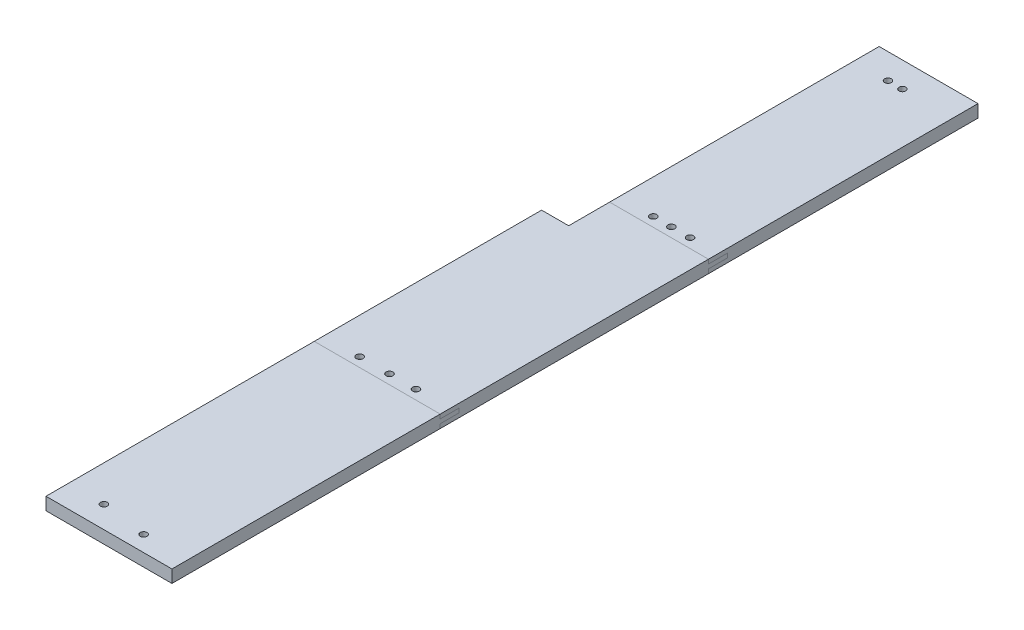
from build123d import *

# Parameters (mm, degrees)
BOSS_EXTRUDE1_DEPTH     = 10
CUT_EXTRUDE1_DEPTH      = 371.163218123
CUT_EXTRUDE1_DEPTH_BACK = 371.163218123
SKETCH2_W               = 11.607476636
SKETCH2_H               = 200
SKETCH3_W               = 10
SKETCH3_H               = 200
BOSS_EXTRUDE2_DEPTH     = 10
SKETCH4_W               = 1.61
SKETCH4_H               = 200
BOSS_EXTRUDE3_DEPTH     = 10
CUT_EXTRUDE2_DEPTH      = 371.163218123
CUT_EXTRUDE2_DEPTH_BACK = 371.163218123
SKETCH6_W               = 2.5
SKETCH6_H               = 200
SKETCH6_H_2             = 440
SKETCH7_W               = 9.997476636
SKETCH7_H               = 200
BOSS_EXTRUDE4_DEPTH     = 10
SKETCH8_W               = 40
SKETCH8_H               = 100
BOSS_EXTRUDE5_DEPTH     = 10
SKETCH9_W               = 2
SKETCH9_H               = 200
SKETCH9_W_2             = 3.5
SKETCH9_H_2             = 440
BOSS_EXTRUDE6_DEPTH     = 10
CUT_EXTRUDE3_DEPTH      = 372.00512896
CUT_EXTRUDE3_DEPTH_BACK = 372.00512896
SKETCH10_W              = 21.5
SKETCH10_H              = 46.5
CUT_EXTRUDE4_DEPTH      = 372.00512896
CUT_EXTRUDE4_DEPTH_BACK = 372.00512896
SKETCH11_R              = 2.65
SKETCH12_R              = 2.7
CUT_EXTRUDE5_DEPTH      = 372.00512896
SKETCH15_R              = 2.7
CUT_EXTRUDE6_DEPTH      = 372.00512896
SPLIT1_OUTLINE_W        = 78.5
SPLIT1_OUTLINE_H        = 199
SPLIT1_OUTLINE_R        = 2.65
SPLIT1_DEPTH            = 10
SPLIT1_2_OUTLINE_W      = 78.5
SPLIT1_2_OUTLINE_H      = 15
SPLIT1_2_OUTLINE_R      = 2.7
SPLIT1_2_DEPTH          = 3.33
SPLIT1_START            = 6.67
SPLIT1_3_OUTLINE_W      = 78.5
SPLIT1_3_OUTLINE_H      = 15
SPLIT1_3_OUTLINE_R      = 2.7
SPLIT1_3_DEPTH          = 3.33
SPLIT1_4_DEPTH          = 10
SPLIT1_5_OUTLINE_W      = 100
SPLIT1_5_OUTLINE_H      = 15
SPLIT1_5_OUTLINE_R      = 2.7
SPLIT1_5_DEPTH          = 3.33
SPLIT1_6_OUTLINE_W      = 100
SPLIT1_6_OUTLINE_H      = 15
SPLIT1_6_OUTLINE_R      = 2.7
SPLIT1_6_DEPTH          = 3.33
SPLIT1_START_2          = 3.33
SPLIT1_7_OUTLINE_W      = 78.5
SPLIT1_7_OUTLINE_H      = 15
SPLIT1_7_OUTLINE_R      = 2.7
SPLIT1_7_DEPTH          = 3.34
SPLIT1_8_OUTLINE_R      = 2.7
SPLIT1_8_OUTLINE_R_2    = 2.65
SPLIT1_8_DEPTH          = 10
SPLIT1_9_OUTLINE_W      = 100
SPLIT1_9_OUTLINE_H      = 15
SPLIT1_9_OUTLINE_R      = 2.7
SPLIT1_9_DEPTH          = 3.33
SPLIT1_10_OUTLINE_W     = 100
SPLIT1_10_OUTLINE_H     = 15
SPLIT1_10_OUTLINE_R     = 2.7
SPLIT1_10_DEPTH         = 3.33


# Read off the part's stored shape, not the designer's step: Split1
with BuildPart() as part:
    # Sketch1 → Boss-Extrude1 (new body)
    with BuildSketch(Plane(origin=(0, 0, 0), x_dir=(1, 0, 0), z_dir=(0, 1, 0))):
        Polygon((-57.392523364, 280.440053801), (11.607476636, 280.440053801), (11.607476636, 80.440053801), (11.607476636, -259.559946199), (11.607476636, -359.559946199), (-47.392523364, -359.559946199), (-47.392523364, -259.559946199), (-87.392523364, -259.559946199), (-87.392523364, 80.440053801), (-57.392523364, 80.440053801), align=None)
    extrude(amount=BOSS_EXTRUDE1_DEPTH)

    # Sketch2 → Cut-Extrude1 (cut, two sides: drawn at the far end of the back side and taken through both)
    with BuildSketch(Plane(origin=(0, 10, 0), x_dir=(1, 0, 0), z_dir=(0, 1, 0)).offset(-CUT_EXTRUDE1_DEPTH_BACK)):
        with Locations((5.803738318, 180.440053801)):
            Rectangle(SKETCH2_W, SKETCH2_H)
    extrude(amount=CUT_EXTRUDE1_DEPTH + CUT_EXTRUDE1_DEPTH_BACK, mode=Mode.SUBTRACT)

    # Sketch3 → Boss-Extrude2 (add)
    with BuildSketch(Plane(origin=(0, 10, 0), x_dir=(1, 0, 0), z_dir=(0, 1, 0))):
        with Locations((-62.392523364, 180.440053801)):
            Rectangle(SKETCH3_W, SKETCH3_H)
    extrude(amount=-BOSS_EXTRUDE2_DEPTH)

    # Sketch4 → Boss-Extrude3 (add)
    with BuildSketch(Plane(origin=(0, 10, 0), x_dir=(1, 0, 0), z_dir=(0, 1, 0))):
        with Locations((0.805, 180.440053801)):
            Rectangle(SKETCH4_W, SKETCH4_H)
    extrude(amount=-BOSS_EXTRUDE3_DEPTH)

    # Sketch6 → Cut-Extrude2 (cut, two sides: drawn at the far end of the back side and taken through both)
    with BuildSketch(Plane(origin=(0, 10, 0), x_dir=(1, 0, 0), z_dir=(0, 1, 0)).offset(-CUT_EXTRUDE2_DEPTH_BACK)):
        with Locations((0.36, 180.440053801)):
            Rectangle(SKETCH6_W, SKETCH6_H)
        with Locations((10.357476636, -139.559946199)):
            Rectangle(SKETCH6_W, SKETCH6_H_2)
    extrude(amount=CUT_EXTRUDE2_DEPTH + CUT_EXTRUDE2_DEPTH_BACK, mode=Mode.SUBTRACT)

    # Sketch7 → Boss-Extrude4 (add)
    with BuildSketch(Plane(origin=(0, 10, 0), x_dir=(1, 0, 0), z_dir=(0, 1, 0))):
        with Locations((4.108738318, 180.440053801)):
            Rectangle(SKETCH7_W, SKETCH7_H)
    extrude(amount=-BOSS_EXTRUDE4_DEPTH)

    # Sketch8 → Boss-Extrude5 (add)
    with BuildSketch(Plane(origin=(0, 10, 0), x_dir=(1, 0, 0), z_dir=(0, 1, 0))):
        with Locations((-67.392523364, -309.559946199)):
            Rectangle(SKETCH8_W, SKETCH8_H)
    extrude(amount=-BOSS_EXTRUDE5_DEPTH)

    # Sketch9 → Boss-Extrude6 (add)
    with BuildSketch(Plane(origin=(0, 10, 0), x_dir=(1, 0, 0), z_dir=(0, 1, 0))):
        with Locations((-68.392523364, 180.440053801)):
            Rectangle(SKETCH9_W, SKETCH9_H)
        with Locations((-89.142523364, -139.559946199)):
            Rectangle(SKETCH9_W_2, SKETCH9_H_2)
    extrude(amount=-BOSS_EXTRUDE6_DEPTH)

    # Sketch10 → Cut-Extrude3 (cut, two sides: drawn at the far end of the back side and taken through both)
    with BuildSketch(Plane(origin=(0, 10, 0), x_dir=(1, 0, 0), z_dir=(0, 1, 0)).offset(-CUT_EXTRUDE3_DEPTH_BACK)):
        with Locations((-80.142523364, 57.190053801)):
            Rectangle(SKETCH10_W, SKETCH10_H)
    extrude(amount=CUT_EXTRUDE3_DEPTH + CUT_EXTRUDE3_DEPTH_BACK, mode=Mode.SUBTRACT)

    # Sketch11 → Cut-Extrude4 (cut, two sides: drawn at the far end of the back side and taken through both)
    with BuildSketch(Plane(origin=(0, 10, 0), x_dir=(1, 0, 0), z_dir=(0, 1, 0)).offset(-CUT_EXTRUDE4_DEPTH_BACK)):
        with Locations(Location((-42.392523364, 260.440053801, 0), (0, 0, 270))):
            Circle(SKETCH11_R)
        with Locations(Location((-30.892523364, 260.440053801, 0), (0, 0, 270))):
            Circle(SKETCH11_R)
    extrude(amount=CUT_EXTRUDE4_DEPTH + CUT_EXTRUDE4_DEPTH_BACK, mode=Mode.SUBTRACT)

    # Sketch12 → Cut-Extrude5 (cut, through all)
    with BuildSketch(Plane(origin=(0, 10, 0), x_dir=(1, 0, 0), z_dir=(0, 1, 0))):
        with Locations(Location((-62.392523364, -342.059946199, 0), (0, 0, 270))):
            Circle(SKETCH12_R)
        with Locations(Location((-25.892523364, -347.059946199, 0), (0, 0, 270))):
            Circle(SKETCH12_R)
    extrude(amount=-CUT_EXTRUDE5_DEPTH, mode=Mode.SUBTRACT)

    # Sketch15 → Cut-Extrude6 (cut, through all)
    with BuildSketch(Plane(origin=(0, 10, 0), x_dir=(1, 0, 0), z_dir=(0, 1, 0))):
        with Locations(Location((-17.647279198, -139.059946199, 0), (0, 0, 270))):
            Circle(SKETCH15_R)
        with Locations(Location((-62.354533308, -139.059946199, 0), (0, 0, 270))):
            Circle(SKETCH15_R)
        with Locations(Location((-42.179244707, 73.940053801, 0), (0, 0, 270))):
            Circle(SKETCH15_R)
        with Locations(Location((-13.000500169, 73.940053801, 0), (0, 0, 270))):
            Circle(SKETCH15_R)
        with Locations(Location((-27.878199953, 73.940053801, 0), (0, 0, 270))):
            Circle(SKETCH15_R)
        with Locations(Location((-38.649605083, -139.059946199, 0), (0, 0, 270))):
            Circle(SKETCH15_R)
    extrude(amount=-CUT_EXTRUDE6_DEPTH, mode=Mode.SUBTRACT)

    # Split1 8 outline → Split1 8 (cut)
    with BuildSketch(Plane(origin=(0, 0, 0), x_dir=(1, 0, 0), z_dir=(0, 1, 0))):
        Polygon((-90.892523364, 33.940053801), (-90.892523364, -131.559946199), (9.107476636, -131.559946199), (9.107476636, 280.440053801), (-69.392523364, 280.440053801), (-69.392523364, 33.940053801), align=None)
        with Locations((-42.179244707, 73.940053801)):
            Circle(SPLIT1_8_OUTLINE_R, mode=Mode.SUBTRACT)
        with Locations((-42.392523364, 260.440053801)):
            Circle(SPLIT1_8_OUTLINE_R_2, mode=Mode.SUBTRACT)
        with Locations((-27.878199953, 73.940053801)):
            Circle(SPLIT1_8_OUTLINE_R, mode=Mode.SUBTRACT)
        with Locations((-13.000500169, 73.940053801)):
            Circle(SPLIT1_8_OUTLINE_R, mode=Mode.SUBTRACT)
        with Locations((-30.892523364, 260.440053801)):
            Circle(SPLIT1_8_OUTLINE_R_2, mode=Mode.SUBTRACT)
    extrude(amount=SPLIT1_8_DEPTH, mode=Mode.SUBTRACT)

    # Split1 9 outline → Split1 9 (cut)
    with BuildSketch(Plane(origin=(0, 0, 0), x_dir=(1, 0, 0), z_dir=(0, 1, 0))):
        with Locations((-40.892523364, -139.059946199)):
            Rectangle(SPLIT1_9_OUTLINE_W, SPLIT1_9_OUTLINE_H)
        with Locations((-62.354533308, -139.059946199)):
            Circle(SPLIT1_9_OUTLINE_R, mode=Mode.SUBTRACT)
        with Locations((-38.649605083, -139.059946199)):
            Circle(SPLIT1_9_OUTLINE_R, mode=Mode.SUBTRACT)
        with Locations((-17.647279198, -139.059946199)):
            Circle(SPLIT1_9_OUTLINE_R, mode=Mode.SUBTRACT)
    extrude(amount=SPLIT1_9_DEPTH, mode=Mode.SUBTRACT)

    # Split1 10 outline → Split1 10 (cut)
    with BuildSketch(Plane(origin=(0, 0, 0), x_dir=(1, 0, 0), z_dir=(0, 1, 0)).offset(SPLIT1_START)):
        with Locations((-40.892523364, -139.059946199)):
            Rectangle(SPLIT1_10_OUTLINE_W, SPLIT1_10_OUTLINE_H)
        with Locations((-62.354533308, -139.059946199)):
            Circle(SPLIT1_10_OUTLINE_R, mode=Mode.SUBTRACT)
        with Locations((-38.649605083, -139.059946199)):
            Circle(SPLIT1_10_OUTLINE_R, mode=Mode.SUBTRACT)
        with Locations((-17.647279198, -139.059946199)):
            Circle(SPLIT1_10_OUTLINE_R, mode=Mode.SUBTRACT)
    extrude(amount=SPLIT1_10_DEPTH, mode=Mode.SUBTRACT)


with BuildPart() as body_2:
    # Split1 outline → Split1 (new body)
    with BuildSketch(Plane(origin=(0, 0, 0), x_dir=(1, 0, 0), z_dir=(0, 1, 0))):
        with Locations((-30.142523364, 180.940053801)):
            Rectangle(SPLIT1_OUTLINE_W, SPLIT1_OUTLINE_H)
        with Locations((-42.392523364, 260.440053801)):
            Circle(SPLIT1_OUTLINE_R, mode=Mode.SUBTRACT)
        with Locations((-30.892523364, 260.440053801)):
            Circle(SPLIT1_OUTLINE_R, mode=Mode.SUBTRACT)
    extrude(amount=SPLIT1_DEPTH)

    # Split1 2 outline → Split1 2 (add)
    with BuildSketch(Plane(origin=(0, 0, 0), x_dir=(1, 0, 0), z_dir=(0, 1, 0))):
        with Locations((-30.142523364, 73.940053801)):
            Rectangle(SPLIT1_2_OUTLINE_W, SPLIT1_2_OUTLINE_H)
        with Locations((-42.179244707, 73.940053801)):
            Circle(SPLIT1_2_OUTLINE_R, mode=Mode.SUBTRACT)
        with Locations((-27.878199953, 73.940053801)):
            Circle(SPLIT1_2_OUTLINE_R, mode=Mode.SUBTRACT)
        with Locations((-13.000500169, 73.940053801)):
            Circle(SPLIT1_2_OUTLINE_R, mode=Mode.SUBTRACT)
    extrude(amount=SPLIT1_2_DEPTH)

    # Split1 3 outline → Split1 3 (add)
    with BuildSketch(Plane(origin=(0, 0, 0), x_dir=(1, 0, 0), z_dir=(0, 1, 0)).offset(SPLIT1_START)):
        with Locations((-30.142523364, 73.940053801)):
            Rectangle(SPLIT1_3_OUTLINE_W, SPLIT1_3_OUTLINE_H)
        with Locations((-42.179244707, 73.940053801)):
            Circle(SPLIT1_3_OUTLINE_R, mode=Mode.SUBTRACT)
        with Locations((-27.878199953, 73.940053801)):
            Circle(SPLIT1_3_OUTLINE_R, mode=Mode.SUBTRACT)
        with Locations((-13.000500169, 73.940053801)):
            Circle(SPLIT1_3_OUTLINE_R, mode=Mode.SUBTRACT)
    extrude(amount=SPLIT1_3_DEPTH)


with BuildPart() as body_3:
    # Split1 4 outline → Split1 4 (new body)
    with BuildSketch(Plane(origin=(0, 0, 0), x_dir=(1, 0, 0), z_dir=(0, 1, 0))):
        Polygon((9.107476636, 66.440053801), (-69.392523364, 66.440053801), (-69.392523364, 33.940053801), (-90.892523364, 33.940053801), (-90.892523364, -131.559946199), (9.107476636, -131.559946199), align=None)
    extrude(amount=SPLIT1_4_DEPTH)

    # Split1 5 outline → Split1 5 (add)
    with BuildSketch(Plane(origin=(0, 0, 0), x_dir=(1, 0, 0), z_dir=(0, 1, 0))):
        with Locations((-40.892523364, -139.059946199)):
            Rectangle(SPLIT1_5_OUTLINE_W, SPLIT1_5_OUTLINE_H)
        with Locations((-62.354533308, -139.059946199)):
            Circle(SPLIT1_5_OUTLINE_R, mode=Mode.SUBTRACT)
        with Locations((-38.649605083, -139.059946199)):
            Circle(SPLIT1_5_OUTLINE_R, mode=Mode.SUBTRACT)
        with Locations((-17.647279198, -139.059946199)):
            Circle(SPLIT1_5_OUTLINE_R, mode=Mode.SUBTRACT)
    extrude(amount=SPLIT1_5_DEPTH)

    # Split1 6 outline → Split1 6 (add)
    with BuildSketch(Plane(origin=(0, 0, 0), x_dir=(1, 0, 0), z_dir=(0, 1, 0)).offset(SPLIT1_START)):
        with Locations((-40.892523364, -139.059946199)):
            Rectangle(SPLIT1_6_OUTLINE_W, SPLIT1_6_OUTLINE_H)
        with Locations((-62.354533308, -139.059946199)):
            Circle(SPLIT1_6_OUTLINE_R, mode=Mode.SUBTRACT)
        with Locations((-38.649605083, -139.059946199)):
            Circle(SPLIT1_6_OUTLINE_R, mode=Mode.SUBTRACT)
        with Locations((-17.647279198, -139.059946199)):
            Circle(SPLIT1_6_OUTLINE_R, mode=Mode.SUBTRACT)
    extrude(amount=SPLIT1_6_DEPTH)

    # Split1 7 outline → Split1 7 (add)
    with BuildSketch(Plane(origin=(0, 0, 0), x_dir=(1, 0, 0), z_dir=(0, 1, 0)).offset(SPLIT1_START_2)):
        with Locations((-30.142523364, 73.940053801)):
            Rectangle(SPLIT1_7_OUTLINE_W, SPLIT1_7_OUTLINE_H)
        with Locations((-42.179244707, 73.940053801)):
            Circle(SPLIT1_7_OUTLINE_R, mode=Mode.SUBTRACT)
        with Locations((-27.878199953, 73.940053801)):
            Circle(SPLIT1_7_OUTLINE_R, mode=Mode.SUBTRACT)
        with Locations((-13.000500169, 73.940053801)):
            Circle(SPLIT1_7_OUTLINE_R, mode=Mode.SUBTRACT)
    extrude(amount=SPLIT1_7_DEPTH)


solid = Compound([part.part, body_2.part, body_3.part])
